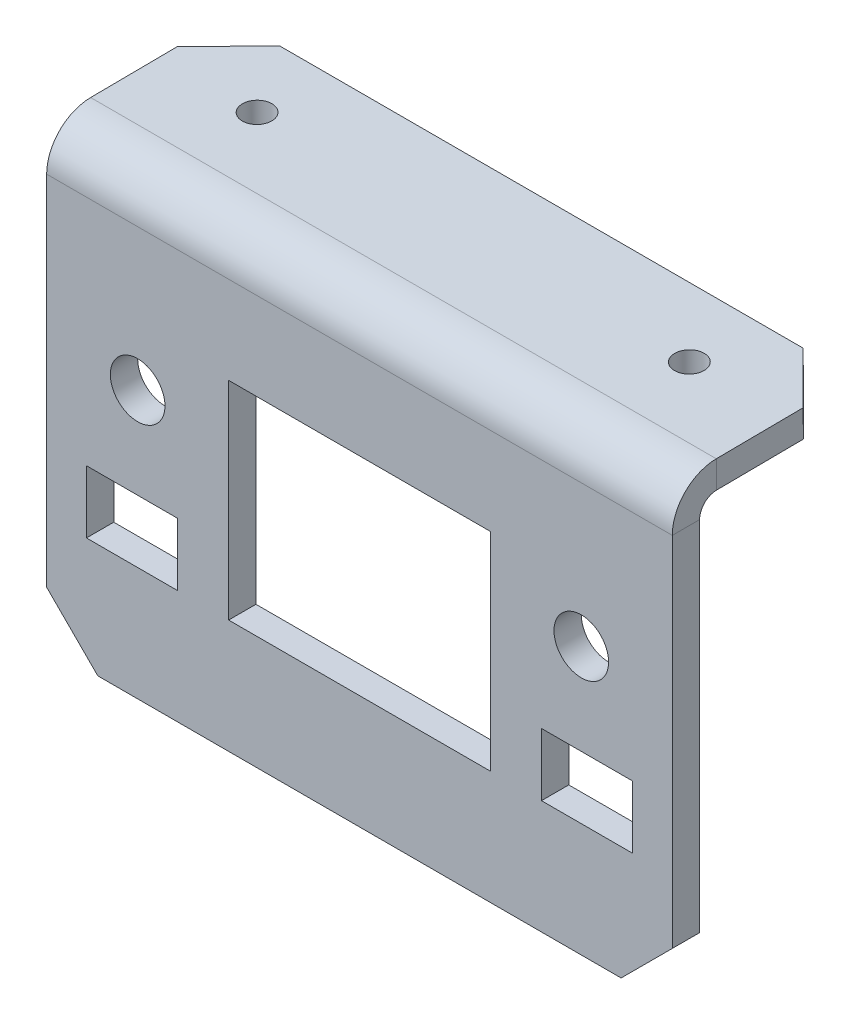
from build123d import *

# Parameters (mm, degrees)
SKETCH2_W              = 27.94
SKETCH2_H              = 20.2692
BOSS_EXTRUDE2_DEPTH    = 8.128
DRAFT1_ANGLE           = 0.5
CONVERT_SOLID1_START   = -13.97
CONVERT_SOLID1_DEPTH   = 27.94
CONVERT_SOLID1_2_DEPTH = 27.94
SKETCH26_R             = 0.6604
CUT_EXTRUDE6_DEPTH     = 27.664739949
SKETCH16_R             = 1.2192
SKETCH16_W             = 4.064
SKETCH16_H             = 2.794
CUT_EXTRUDE4_DEPTH     = 60.515150005
SKETCH35_W             = 11.684
SKETCH35_H             = 9.271
CUT_EXTRUDE7_DEPTH     = 3.81
CHAMFER1_SIZE          = 2.286


# Read off the part's stored shape, not the designer's step: Convert-Solid1
with BuildPart() as part:
    # Sketch2 → Boss-Extrude2 (new body)
    with BuildSketch(Plane.XY):
        with Locations((0, -1.8034)):
            Rectangle(SKETCH2_W, SKETCH2_H)
    extrude(amount=-BOSS_EXTRUDE2_DEPTH)

    # Draft1
    draft1_faces = [part.faces().sort_by_distance(p)[0] for p in [
        (0, 8.3312, -4.064),
    ]]
    draft(draft1_faces, Plane.XY.offset(-5.08), DRAFT1_ANGLE)

    # Convert-Solid1 outline → Convert-Solid1 (cut)
    with BuildSketch(Plane.YZ.offset(CONVERT_SOLID1_START)):
        with BuildLine():
            Line((-11.938, -8.128), (7.138553067, -8.128))
            Line((7.138553067, -8.128), (7.084852727, -1.97455038))
            ThreePointArc((7.084852727, -1.97455038), (6.859340961, -1.440038744), (6.322881741, -1.2192))
            Line((6.322881741, -1.2192), (-11.938, -1.2192))
            Line((-11.938, -1.2192), (-11.938, -8.128))
        make_face()
        with BuildLine():
            ThreePointArc((6.322881741, 0), (7.717675713, -0.574180734), (8.304006303, -1.963910988))
            Line((8.304006303, -1.963910988), (8.286867512, 0))
            Line((8.286867512, 0), (6.322881741, 0))
        make_face()
    extrude(amount=CONVERT_SOLID1_DEPTH, mode=Mode.SUBTRACT)

    # Convert-Solid1 2 outline → Convert-Solid1 2 (add)
    with BuildSketch(Plane.YZ.offset(CONVERT_SOLID1_START)):
        Polygon((7.138553067, -8.128), (7.138645916, -8.138639392), (8.357799493, -8.128), align=None)
    extrude(amount=CONVERT_SOLID1_2_DEPTH)

    # Sketch26 → Cut-Extrude6 (cut, through all)
    with BuildSketch(Plane(origin=(0, 8.375524998, -10.159141632), x_dir=(1, 0, 0), z_dir=(0, -0.9999619230641713, -0.008726535498373954))):
        with Locations(Location((9.652, 5.079528476, 0), (0, 0, 270))):
            Circle(SKETCH26_R)
        Polygon((9.887639275, 0.235167751), (15.766051224, 6.1135797), (15.766051224, 0.235167751), align=None)
    cut_extrude6 = extrude(amount=CUT_EXTRUDE6_DEPTH, mode=Mode.SUBTRACT)

    # Sketch16 → Cut-Extrude4 (cut, through all)
    with BuildSketch(Plane(origin=(0, 45.339, 0), x_dir=(1, 0, 0), z_dir=(0, 0, -1))):
        with Locations(Location((9.906, 45.339, 0), (0, 0, 180))):
            Circle(SKETCH16_R)
        with Locations((10.16, 50.8)):
            Rectangle(SKETCH16_W, SKETCH16_H)
    cut_extrude4 = extrude(amount=CUT_EXTRUDE4_DEPTH, mode=Mode.SUBTRACT)

    # Mirror1: Cut-Extrude6, Cut-Extrude4 across plane
    add(cut_extrude6.mirror(Plane(origin=(0, 0, 0), x_dir=(0, 0, 1), z_dir=(1, 0, 0))), mode=Mode.SUBTRACT)
    add(cut_extrude4.mirror(Plane(origin=(0, 0, 0), x_dir=(0, 0, 1), z_dir=(1, 0, 0))), mode=Mode.SUBTRACT)

    # Sketch35 → Cut-Extrude7 (cut)
    with BuildSketch(Plane.XY):
        with Locations((0, -2.2225)):
            Rectangle(SKETCH35_W, SKETCH35_H)
    extrude(amount=-CUT_EXTRUDE7_DEPTH, mode=Mode.SUBTRACT)

    # Chamfer1
    chamfer1_edges = [part.edges().sort_by_distance(p)[0] for p in [
        (13.97, -11.938, -0.6096),
        (-13.97, -11.938, -0.6096),
    ]]
    chamfer(chamfer1_edges, length=CHAMFER1_SIZE)


solid = part.part
